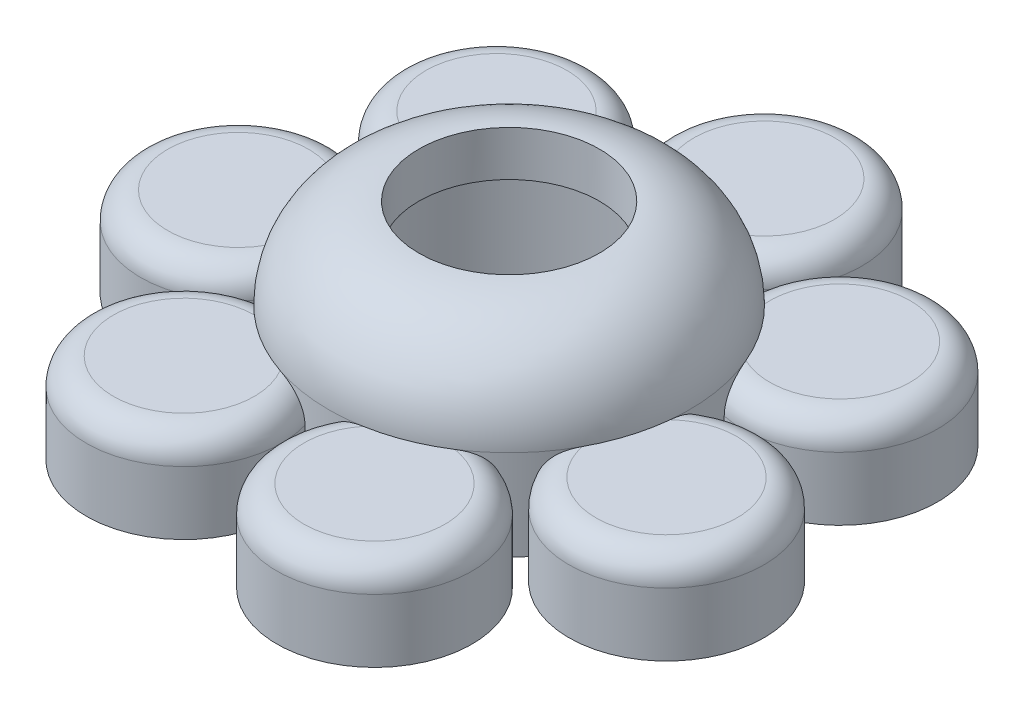
from build123d import *

# Parameters (mm, degrees)
SKETCH3_R           = 20
BOSS_EXTRUDE2_DEPTH = 20
FILLET2_R           = 10
SKETCH4_R           = 10
CUT_EXTRUDE1_DEPTH  = 35.641016209
SKETCH5_R           = 17
CUT_EXTRUDE3_DEPTH  = 15
BOSS_EXTRUDE3_DEPTH = 10
FILLET4_R           = 3


with BuildPart() as part:
    # Sketch3 → Boss-Extrude2 (new body)
    with BuildSketch(Plane(origin=(0, 0, 0), x_dir=(1, 0, 0), z_dir=(0, 1, 0))):
        with Locations(Location((0, 0, 0), (0, 0, 270))):
            Circle(SKETCH3_R)
    extrude(amount=BOSS_EXTRUDE2_DEPTH)

    # Fillet2
    fillet2_edges = [part.edges().sort_by_distance(p)[0] for p in [
        (0, 20, -20),
    ]]
    fillet(fillet2_edges, radius=FILLET2_R)

    # Sketch4 → Cut-Extrude1 (cut, through all)
    with BuildSketch(Plane(origin=(0, 20, 0), x_dir=(1, 0, 0), z_dir=(0, 1, 0))):
        with Locations(Location((0, 0, 0), (0, 0, 270))):
            Circle(SKETCH4_R)
    extrude(amount=-CUT_EXTRUDE1_DEPTH, mode=Mode.SUBTRACT)

    # Sketch5 → Cut-Extrude3 (cut)
    with BuildSketch(Plane.XZ):
        with Locations(Location((0, 0, 0), (0, 0, 270))):
            Circle(SKETCH5_R)
    extrude(amount=-CUT_EXTRUDE3_DEPTH, mode=Mode.SUBTRACT)

    # Sketch6 → Boss-Extrude3 (add)
    with BuildSketch(Plane.XZ):
        with BuildLine():
            ThreePointArc((19.534507746, -4.289872624), (16.523043018, -11.268941807), (11.12497647, -16.620315838))
            ThreePointArc((11.12497647, -16.620315838), (30.716158677, -20.948841221), (19.534507746, -4.289872624))
        make_face()
        with BuildLine():
            ThreePointArc((19.930595545, -1.664740583), (35.529675275, 10.953471012), (15.533523837, 12.598001318))
            ThreePointArc((15.533523837, 12.598001318), (18.850337885, 6.683170029), (20, 0))
            ThreePointArc((20, 0), (19.982641353, -0.83309336), (19.930595545, -1.664740583))
        make_face()
        with BuildLine():
            ThreePointArc((13.728069665, 14.544418286), (13.588621718, 34.607596163), (-0.164520348, 19.999323315))
            ThreePointArc((-0.164520348, 19.999323315), (7.309682944, 18.616351287), (13.728069665, 14.544418286))
        make_face()
        with BuildLine():
            ThreePointArc((-2.811972675, 19.801333533), (-18.584941151, 32.201495537), (-15.738677355, 12.340746944))
            ThreePointArc((-15.738677355, 12.340746944), (-9.997336755, 17.322045428), (-2.811972675, 19.801333533))
        make_face()
        with BuildLine():
            ThreePointArc((-17.234542237, 10.147440756), (-36.763664269, 5.54701198), (-19.461289303, -4.610663581))
            ThreePointArc((-19.461289303, -4.610663581), (-19.776157969, 2.983886056), (-17.234542237, 10.147440756))
        make_face()
        with BuildLine():
            ThreePointArc((-8.529153468, -18.090150389), (-14.663128872, -13.601200376), (-18.679149974, -7.14768188))
            ThreePointArc((-18.679149974, -7.14768188), (-27.25859835, -25.284484736), (-8.529153468, -18.090150389))
        make_face()
        with BuildLine():
            ThreePointArc((8.825608891, -17.947384982), (1.491535339, -19.944305511), (-6.057976796, -19.060454274))
            ThreePointArc((-6.057976796, -19.060454274), (2.7727481, -37.076248736), (8.825608891, -17.947384982))
        make_face()
    extrude(amount=-BOSS_EXTRUDE3_DEPTH)

    # Fillet4
    # the kernel refuses this fillet: 3 mm, written as the material it takes off along each edge
    with BuildSketch(Plane(origin=(21.787771386, 10, -14.859558714), x_dir=(-0.8613411629371903, 0, 0.5080269688018624), z_dir=(0.5080269688018624, 0, 0.8613411629371903))) as fillet4_piece_1_section:
        with BuildLine():
            CenterArc((10.807194875 - FILLET4_R, FILLET4_R), FILLET4_R, 270, 90)
            Line((10.807194875, FILLET4_R), (10.807194875, 0))
            Line((10.807194875, 0), (10.807194875 - FILLET4_R, 0))
        make_face()
    fillet4_piece_1 = revolve(axis=Axis((21.787771386, 10, -14.859558714), (0, -1, 0)), revolution_arc=352.475944856, mode=Mode.PRIVATE)
    fillet4_piece_1 = fillet4_piece_1 - Plane(origin=(0, 9.153525429, 0), x_dir=(0, 0, 1), z_dir=(0, -1, 0)) * Cylinder(20, 44, mode=Mode.PRIVATE)
    add(fillet4_piece_1, mode=Mode.SUBTRACT)
    with BuildSketch(Plane(origin=(25.202124082, 10, 7.769582284), x_dir=(-0.9342289091645791, 0, -0.3566740042127554), z_dir=(-0.3566740042127554, 0, 0.9342289091645791))) as fillet4_piece_2_section:
        with BuildLine():
            CenterArc((10.807194875 - FILLET4_R, FILLET4_R), FILLET4_R, 270, 90)
            Line((10.807194875 - FILLET4_R, 0), (10.807194875, 0))
            Line((10.807194875, 0), (10.807194875, FILLET4_R))
        make_face()
    fillet4_piece_2 = revolve(axis=Axis((25.202124082, 10, 7.769582284), (0, -1, 0)), revolution_arc=352.475944856, mode=Mode.PRIVATE)
    fillet4_piece_2 = fillet4_piece_2 - Plane(origin=(0, 9.954455144, 0), x_dir=(0, 0, 1), z_dir=(0, -1, 0)) * Cylinder(20, 44, mode=Mode.PRIVATE)
    add(fillet4_piece_2, mode=Mode.SUBTRACT)
    with BuildSketch(Plane(origin=(9.638763315, 10, 24.548069352), x_dir=(-0.30362323199425595, 0, -0.9527921772314055), z_dir=(-0.9527921772314055, 0, 0.30362323199425595))) as fillet4_piece_3_section:
        with BuildLine():
            CenterArc((10.807194875 - FILLET4_R, FILLET4_R), FILLET4_R, 270, 90)
            Line((10.807194875 - FILLET4_R, 0), (10.807194875, 0))
            Line((10.807194875, 0), (10.807194875, FILLET4_R))
        make_face()
    fillet4_piece_3 = revolve(axis=Axis((9.638763315, 10, 24.548069352), (0, -1, 0)), revolution_arc=352.475944856, mode=Mode.PRIVATE)
    fillet4_piece_3 = fillet4_piece_3 - Plane(origin=(0, 9.954455222, 0), x_dir=(0, 0, 1), z_dir=(0, -1, 0)) * Cylinder(20, 44, mode=Mode.PRIVATE)
    add(fillet4_piece_3, mode=Mode.SUBTRACT)
    with BuildSketch(Plane(origin=(-13.182782823, 10, 22.841359508), x_dir=(0.5556169316529679, 0, -0.831438407376362), z_dir=(-0.831438407376362, 0, -0.5556169316529679))) as fillet4_piece_4_section:
        with BuildLine():
            CenterArc((10.807194875 - FILLET4_R, FILLET4_R), FILLET4_R, 270, 90)
            Line((10.807194875, FILLET4_R), (10.807194875, 0))
            Line((10.807194875, 0), (10.807194875 - FILLET4_R, 0))
        make_face()
    fillet4_piece_4 = revolve(axis=Axis((-13.182782823, 10, 22.841359508), (0, -1, 0)), revolution_arc=352.475944856, mode=Mode.PRIVATE)
    fillet4_piece_4 = fillet4_piece_4 - Plane(origin=(0, 9.153525429, 0), x_dir=(0, 0, 1), z_dir=(0, -1, 0)) * Cylinder(20, 44, mode=Mode.PRIVATE)
    add(fillet4_piece_4, mode=Mode.SUBTRACT)
    with BuildSketch(Plane(origin=(-26.077424616, 10, 3.934640076), x_dir=(0.9964662132455853, 0, -0.08399455851424971), z_dir=(-0.08399455851424971, 0, -0.9964662132455853))) as fillet4_piece_5_section:
        with BuildLine():
            CenterArc((10.807194875 - FILLET4_R, FILLET4_R), FILLET4_R, 270, 90)
            Line((10.807194875, FILLET4_R), (10.807194875, 0))
            Line((10.807194875, 0), (10.807194875 - FILLET4_R, 0))
        make_face()
    fillet4_piece_5 = revolve(axis=Axis((-26.077424616, 10, 3.934640076), (0, -1, 0)), revolution_arc=352.475944856, mode=Mode.PRIVATE)
    fillet4_piece_5 = fillet4_piece_5 - Plane(origin=(0, 9.153525429, 0), x_dir=(0, 0, 1), z_dir=(0, -1, 0)) * Cylinder(20, 44, mode=Mode.PRIVATE)
    add(fillet4_piece_5, mode=Mode.SUBTRACT)
    with BuildSketch(Plane(origin=(-19.33523379, 10, -17.934943585), x_dir=(0.6869561120578647, 0, 0.7266989060858304), z_dir=(0.7266989060858304, 0, -0.6869561120578647))) as fillet4_piece_6_section:
        with BuildLine():
            CenterArc((10.807194875 - FILLET4_R, FILLET4_R), FILLET4_R, 270, 90)
            Line((10.807194875, FILLET4_R), (10.807194875, 0))
            Line((10.807194875, 0), (10.807194875 - FILLET4_R, 0))
        make_face()
    fillet4_piece_6 = revolve(axis=Axis((-19.33523379, 10, -17.934943585), (0, -1, 0)), revolution_arc=352.475944856, mode=Mode.PRIVATE)
    fillet4_piece_6 = fillet4_piece_6 - Plane(origin=(0, 9.153525429, 0), x_dir=(0, 0, 1), z_dir=(0, -1, 0)) * Cylinder(20, 44, mode=Mode.PRIVATE)
    add(fillet4_piece_6, mode=Mode.SUBTRACT)
    with BuildSketch(Plane(origin=(1.966782447, 10, -26.29914892), x_dir=(-0.13984595286037754, 0, 0.990173272447087), z_dir=(0.990173272447087, 0, 0.13984595286037754))) as fillet4_piece_7_section:
        with BuildLine():
            CenterArc((10.807194875 - FILLET4_R, FILLET4_R), FILLET4_R, 270, 90)
            Line((10.807194875, FILLET4_R), (10.807194875, 0))
            Line((10.807194875, 0), (10.807194875 - FILLET4_R, 0))
        make_face()
    fillet4_piece_7 = revolve(axis=Axis((1.966782447, 10, -26.29914892), (0, -1, 0)), revolution_arc=352.475944856, mode=Mode.PRIVATE)
    fillet4_piece_7 = fillet4_piece_7 - Plane(origin=(0, 9.153525429, 0), x_dir=(0, 0, 1), z_dir=(0, -1, 0)) * Cylinder(20, 44, mode=Mode.PRIVATE)
    add(fillet4_piece_7, mode=Mode.SUBTRACT)


solid = part.part
